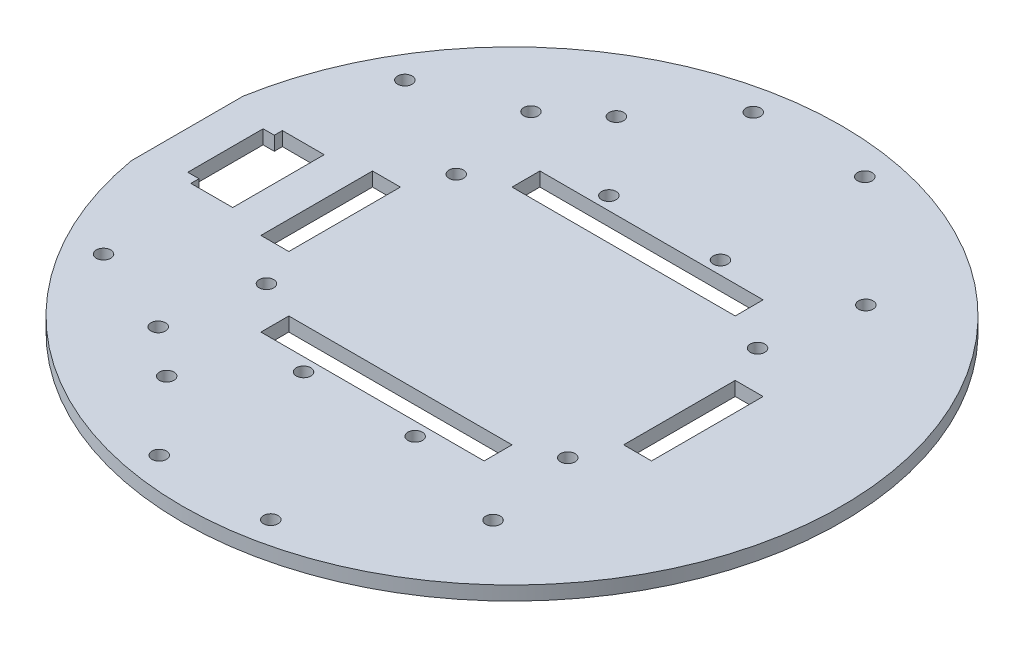
from build123d import *

# Parameters (mm, degrees)
SKETCH1_R           = 1.651
SKETCH1_W           = 50.8
SKETCH1_H           = 6.35
SKETCH1_W_2         = 6.35
SKETCH1_H_2         = 25.4
BOSS_EXTRUDE1_DEPTH = 3.175


with BuildPart() as part:
    # Sketch1 → Boss-Extrude1 (new body)
    with BuildSketch(Plane(origin=(0, 0, 0), x_dir=(1, 0, 0), z_dir=(0, 1, 0))):
        with BuildLine():
            Line((-73.916912814, 12.7), (-73.916912814, -12.7))
            ThreePointArc((-73.916912814, -12.7), (75, 0), (-73.916912814, 12.7))
        make_face()
        with Locations((-34.29, 21.59)):
            Circle(SKETCH1_R, mode=Mode.SUBTRACT)
        with Locations((34.29, 21.59)):
            Circle(SKETCH1_R, mode=Mode.SUBTRACT)
        with Locations((-34.29, -21.59)):
            Circle(SKETCH1_R, mode=Mode.SUBTRACT)
        with Locations((34.29, -21.59)):
            Circle(SKETCH1_R, mode=Mode.SUBTRACT)
        with Locations((38.1, -42.418)):
            Circle(SKETCH1_R, mode=Mode.SUBTRACT)
        with Locations((-38.1, -42.418)):
            Circle(SKETCH1_R, mode=Mode.SUBTRACT)
        with Locations((-58.676912814, -34.29)):
            Circle(SKETCH1_R, mode=Mode.SUBTRACT)
        with Locations((-58.676912814, 34.29)):
            Circle(SKETCH1_R, mode=Mode.SUBTRACT)
        with Locations((-38.1, 42.418)):
            Circle(SKETCH1_R, mode=Mode.SUBTRACT)
        with Locations((38.1, 42.418)):
            Circle(SKETCH1_R, mode=Mode.SUBTRACT)
        with Locations((12.7, -67.593386492)):
            Circle(SKETCH1_R, mode=Mode.SUBTRACT)
        with Locations((12.7, -34.743386492)):
            Circle(SKETCH1_R, mode=Mode.SUBTRACT)
        with Locations((12.7, 34.743386492)):
            Circle(SKETCH1_R, mode=Mode.SUBTRACT)
        with Locations((12.7, 67.593386492)):
            Circle(SKETCH1_R, mode=Mode.SUBTRACT)
        with Locations((-27.425, -51.168386492)):
            Circle(SKETCH1_R, mode=Mode.SUBTRACT)
        with Locations((-12.7, -34.743386492)):
            Circle(SKETCH1_R, mode=Mode.SUBTRACT)
        with Locations((-12.7, -67.593386492)):
            Circle(SKETCH1_R, mode=Mode.SUBTRACT)
        with Locations((-12.7, 67.593386492)):
            Circle(SKETCH1_R, mode=Mode.SUBTRACT)
        with Locations((-27.425, 51.168386492)):
            Circle(SKETCH1_R, mode=Mode.SUBTRACT)
        with Locations((-12.7, 34.743386492)):
            Circle(SKETCH1_R, mode=Mode.SUBTRACT)
        with Locations((0, 28.575)):
            Rectangle(SKETCH1_W, SKETCH1_H, mode=Mode.SUBTRACT)
        with Locations((41.275, 0)):
            Rectangle(SKETCH1_W_2, SKETCH1_H_2, mode=Mode.SUBTRACT)
        with Locations((0, -28.575)):
            Rectangle(SKETCH1_W, SKETCH1_H, mode=Mode.SUBTRACT)
        with Locations((-41.275, 0)):
            Rectangle(SKETCH1_W_2, SKETCH1_H_2, mode=Mode.SUBTRACT)
        Polygon((-65.215956407, 8.5725), (-62.675956407, 8.5725), (-62.675956407, 10.414), (-53.150956407, 10.414), (-53.150956407, 8.5725), (-53.150956407, -8.5725), (-53.150956407, -10.414), (-62.675956407, -10.414), (-62.675956407, -8.5725), (-65.215956407, -8.5725), align=None, mode=Mode.SUBTRACT)
    extrude(amount=BOSS_EXTRUDE1_DEPTH)


solid = part.part
